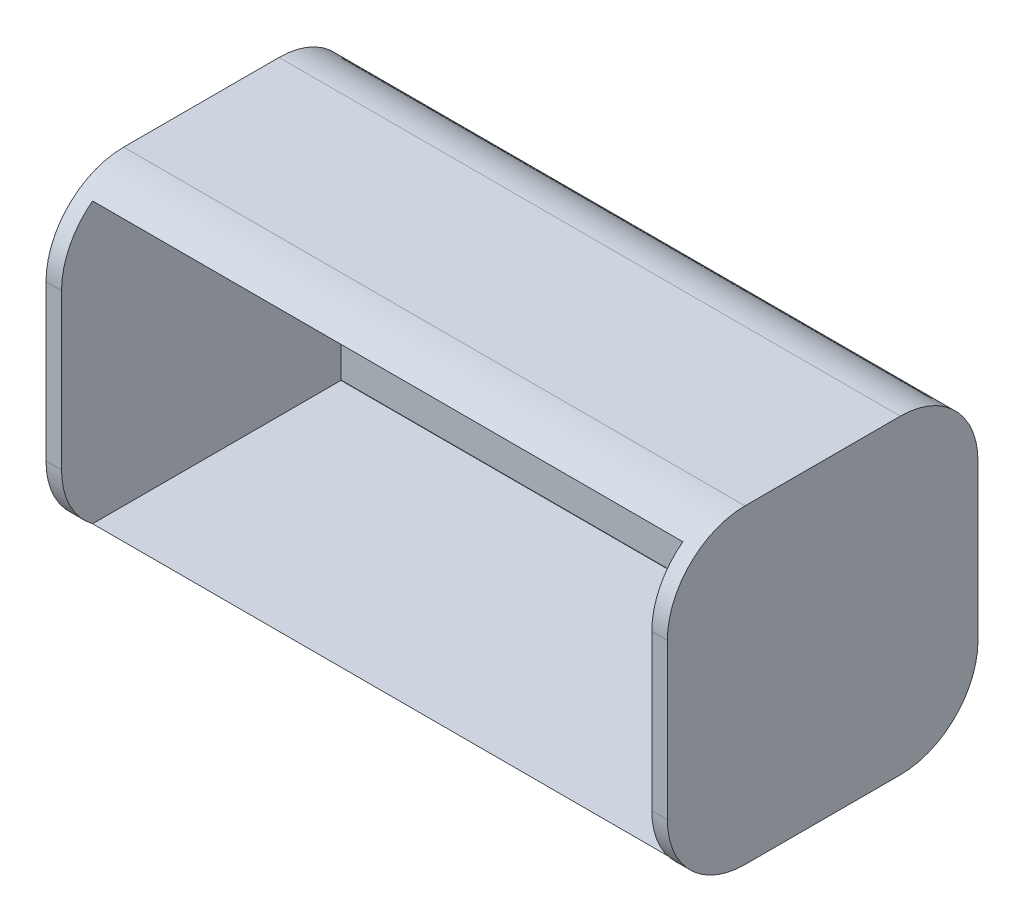
from build123d import *

# Parameters (mm, degrees)
SKETCH_2_W          = 200
SKETCH_2_H          = 100
EXTRUDE_1_DEPTH     = 100
SKETCH_3_W          = 190
SKETCH_3_H          = 90
CUT_EXTRUDE_1_DEPTH = 90
FILLET_1_R          = 25
SKETCH_4_R          = 2
EXTRUDE_2_DEPTH     = 10


with BuildPart() as part:
    # 草图2 → 凸台-拉伸1 (new body)
    with BuildSketch(Plane.XY):
        Rectangle(SKETCH_2_W, SKETCH_2_H)
    extrude(amount=EXTRUDE_1_DEPTH)

    # 草图3 → 切除-拉伸1 (cut)
    with BuildSketch(Plane.XY.offset(100)):
        Rectangle(SKETCH_3_W, SKETCH_3_H)
    extrude(amount=-CUT_EXTRUDE_1_DEPTH, mode=Mode.SUBTRACT)

    # 圆角1
    # the kernel refuses this fillet: 25 mm, written as the material it takes off along each edge
    with BuildSketch(Plane(origin=(162.5, 50, 0), x_dir=(0, -1, 0), z_dir=(-1, 0, 0)), Plane(origin=(-162.5, -50, 100), x_dir=(0, 0, -1), z_dir=(1, 0, 0))) as fillet_1_piece_1:
        with BuildLine():
            CenterArc((FILLET_1_R, FILLET_1_R), FILLET_1_R, 180, 90)
            Line((0, FILLET_1_R), (0, 0))
            Line((0, 0), (FILLET_1_R, 0))
        make_face()
    extrude(amount=325, mode=Mode.SUBTRACT)
    with BuildSketch(Plane(origin=(-162.5, -50, 0), x_dir=(0, 0, 1), z_dir=(1, 0, 0)), Plane(origin=(162.5, 50, 100), x_dir=(0, -1, 0), z_dir=(-1, 0, 0))) as fillet_1_piece_2:
        with BuildLine():
            CenterArc((FILLET_1_R, -FILLET_1_R), FILLET_1_R, 90, 90)
            Line((0, -FILLET_1_R), (0, 0))
            Line((0, 0), (FILLET_1_R, 0))
        make_face()
    extrude(amount=325, mode=Mode.SUBTRACT)

    # 草图4 → 凸台-拉伸2 (add)
    with BuildSketch(Plane.ZY.offset(100)):
        with Locations(Location((50, 0, 0), (0, 0, 180))):
            Circle(SKETCH_4_R)
    extrude(amount=EXTRUDE_2_DEPTH)


solid = part.part
